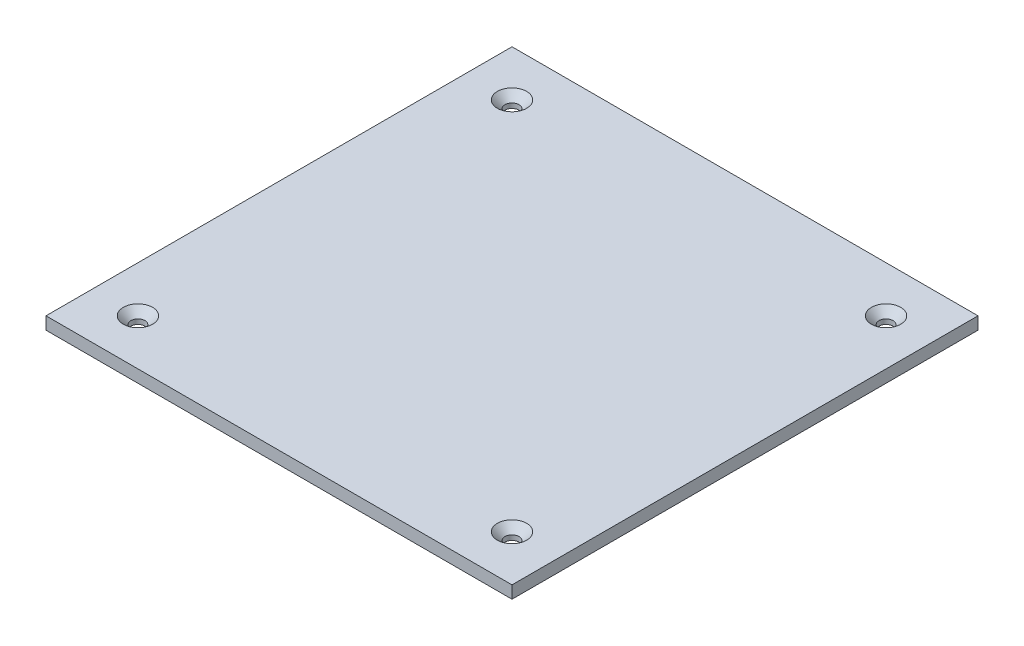
from build123d import *

# Parameters (mm, degrees)
SKETCH1_W                                      = 149.5
SKETCH1_H                                      = 149.5
BASE_FLANGE1_DEPTH                             = 4
CSK_FOR_M4_FLAT_HEAD_MACHINE_SCREW1_AT_2_COUNT = 2
CSK_FOR_M4_FLAT_HEAD_MACHINE_SCREW1_AT_2_PITCH = 120
CSK_FOR_M4_FLAT_HEAD_MACHINE_SCREW1_AT_3_COUNT = 2
CSK_FOR_M4_FLAT_HEAD_MACHINE_SCREW1_AT_3_PITCH = 169.705627485
CSK_FOR_M4_FLAT_HEAD_MACHINE_SCREW1_AT_4_COUNT = 2
CSK_FOR_M4_FLAT_HEAD_MACHINE_SCREW1_AT_4_PITCH = 120


# Sheet-metal steps are written as plain solids
with BuildPart() as part:
    # Sketch1 → Base-Flange1 (new body)
    with BuildSketch(Plane(origin=(0, 0, 0), x_dir=(1, 0, 0), z_dir=(0, 1, 0))):
        Rectangle(SKETCH1_W, SKETCH1_H)
    extrude(amount=-BASE_FLANGE1_DEPTH)

    # Sketch5 → CSK for M4 Flat Head Machine Screw1 (revolve, cut)
    with BuildSketch(Plane(origin=(60, 0, -60), x_dir=(0, 0, 1), z_dir=(1, 0, 0))):
        Polygon((0, 0), (0, 4), (2.25, 4), (2.25, 2.45), (4.7, 0), align=None)
    csk_for_m4_flat_head_machine_screw1 = revolve(axis=Axis((60, 6.35, -60), (0, -1, 0)), mode=Mode.SUBTRACT)

    # CSK for M4 Flat Head Machine Screw1 at 2: CSK for M4 Flat Head Machine Screw1 ×2
    with Locations(*[(-i * CSK_FOR_M4_FLAT_HEAD_MACHINE_SCREW1_AT_2_PITCH, 0, 0) for i in range(1, CSK_FOR_M4_FLAT_HEAD_MACHINE_SCREW1_AT_2_COUNT)]):
        add(csk_for_m4_flat_head_machine_screw1, mode=Mode.SUBTRACT)

    # CSK for M4 Flat Head Machine Screw1 at 3: CSK for M4 Flat Head Machine Screw1 ×2
    with Locations(*[Vector(-0.7071067811865475, 0, 0.7071067811865476) * (i * CSK_FOR_M4_FLAT_HEAD_MACHINE_SCREW1_AT_3_PITCH) for i in range(1, CSK_FOR_M4_FLAT_HEAD_MACHINE_SCREW1_AT_3_COUNT)]):
        add(csk_for_m4_flat_head_machine_screw1, mode=Mode.SUBTRACT)

    # CSK for M4 Flat Head Machine Screw1 at 4: CSK for M4 Flat Head Machine Screw1 ×2
    with Locations(*[(0, 0, i * CSK_FOR_M4_FLAT_HEAD_MACHINE_SCREW1_AT_4_PITCH) for i in range(1, CSK_FOR_M4_FLAT_HEAD_MACHINE_SCREW1_AT_4_COUNT)]):
        add(csk_for_m4_flat_head_machine_screw1, mode=Mode.SUBTRACT)


solid = part.part
